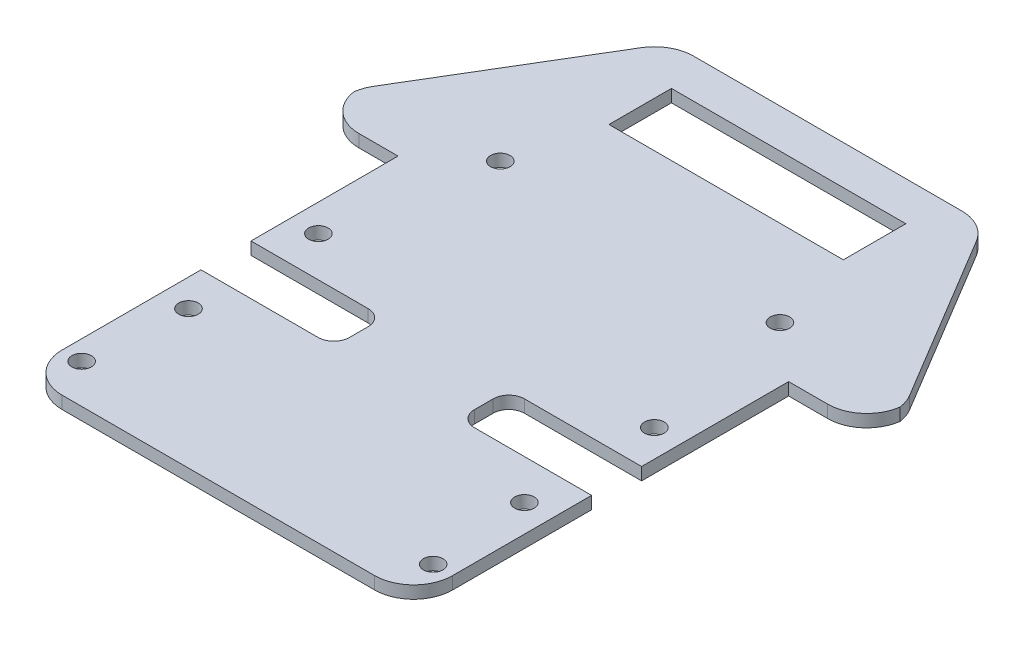
from build123d import *

# Parameters (mm, degrees)
BOSS_EXTRUDE1_DEPTH = 1.6
FILLET1_R           = 5
SKETCH2_R           = 1.25
SKETCH2_W           = 17
SKETCH2_H           = 6.4
SKETCH2_W_2         = 30
SKETCH2_H_2         = 8
CUT_EXTRUDE1_DEPTH  = 3
FILLET2_R           = 2


with BuildPart() as part:
    # Sketch1 → Boss-Extrude1 (new body)
    with BuildSketch(Plane(origin=(0, 0, 0), x_dir=(1, 0, 0), z_dir=(0, 1, 0))):
        Polygon((-20, 55.916666667), (20, 55.916666667), (35, 30.916666667), (35, 25.916666667), (25, 25.916666667), (25, -22.083333333), (-25, -22.083333333), (-25, 25.916666667), (-35, 25.916666667), (-35, 30.916666667), align=None)
    extrude(amount=BOSS_EXTRUDE1_DEPTH)

    # Fillet1
    # the kernel refuses this fillet: 5 mm, written as the material it takes off along each edge
    with BuildSketch(Plane(origin=(-20, -7.077379737, -55.916666667), x_dir=(1, 0, 0), z_dir=(0, 1, 0))) as fillet1_piece_1:
        with BuildLine():
            CenterArc((FILLET1_R * 0.566190378969, -FILLET1_R), FILLET1_R, 90, 59.036243468)
            Line((-FILLET1_R * 0.291302546743, -FILLET1_R * 0.485504244572), (0, 0))
            Line((0, 0), (FILLET1_R * 0.566190378969, 0))
        make_face()
    extrude(amount=15.754759474, mode=Mode.SUBTRACT)
    with BuildSketch(Plane(origin=(20, -7.077379737, -55.916666667), x_dir=(-1, 0, 0), z_dir=(0, 1, 0))) as fillet1_piece_2:
        with BuildLine():
            CenterArc((FILLET1_R * 0.566190378969, FILLET1_R), FILLET1_R, 210.963756532, 59.036243468)
            Line((-FILLET1_R * 0.291302546743, FILLET1_R * 0.485504244572), (0, 0))
            Line((0, 0), (FILLET1_R * 0.566190378969, 0))
        make_face()
    extrude(amount=15.754759474, mode=Mode.SUBTRACT)
    with BuildSketch(Plane(origin=(-35, -3.462299562, -30.916666667), x_dir=(0, 0, 1), z_dir=(0, 1, 0)), Plane(origin=(35, -3.462299562, -30.916666667), x_dir=(-0.5144957554275258, 0, -0.8574929257125447), z_dir=(0, 1, 0))) as fillet1_piece_3:
        with BuildLine():
            CenterArc((FILLET1_R * 0.276983964948, FILLET1_R), FILLET1_R, 239.036243468, 30.963756532)
            Line((-FILLET1_R * 0.237511790479, FILLET1_R * 0.142507074287), (0, 0))
            Line((0, 0), (FILLET1_R * 0.276983964948, 0))
        make_face()
    extrude(amount=8.524599124, mode=Mode.SUBTRACT)
    with BuildSketch(Plane(origin=(-25, -12.5, 22.083333333), x_dir=(1, 0, 0), z_dir=(0, 1, 0)), Plane(origin=(25, -12.5, 22.083333333), x_dir=(0, 0, -1), z_dir=(0, 1, 0)), Plane(origin=(-35, -12.5, -25.916666667), x_dir=(1, 0, 0), z_dir=(0, 1, 0)), Plane(origin=(35, -12.5, -25.916666667), x_dir=(0, 0, -1), z_dir=(0, 1, 0))) as fillet1_piece_4:
        with BuildLine():
            CenterArc((FILLET1_R, FILLET1_R), FILLET1_R, 180, 90)
            Line((0, FILLET1_R), (0, 0))
            Line((0, 0), (FILLET1_R, 0))
        make_face()
    extrude(amount=26.6, mode=Mode.SUBTRACT)

    # Sketch2 → Cut-Extrude1 (cut)
    with BuildSketch(Plane(origin=(0, 0, 0), x_dir=(1, 0, 0), z_dir=(0, 1, 0))):
        with Locations(Location((22.5, -17.083333333, 0), (0, 0, 90))):
            Circle(SKETCH2_R)
        with Locations(Location((21.5, -4.403333333, 0), (0, 0, 90))):
            Circle(SKETCH2_R)
        with Locations(Location((17.9, 31.906666667, 0), (0, 0, 90))):
            Circle(SKETCH2_R)
        with Locations(Location((21.5, 12.226666667, 0), (0, 0, 90))):
            Circle(SKETCH2_R)
        with Locations(Location((-17.9, 31.906666667, 0), (0, 0, 90))):
            Circle(SKETCH2_R)
        with Locations(Location((-21.5, 12.226666667, 0), (0, 0, 90))):
            Circle(SKETCH2_R)
        with Locations(Location((-21.5, -4.403333333, 0), (0, 0, 90))):
            Circle(SKETCH2_R)
        with Locations(Location((-22.5, -17.083333333, 0), (0, 0, 90))):
            Circle(SKETCH2_R)
        with Locations((16.5, 3.896666667)):
            Rectangle(SKETCH2_W, SKETCH2_H)
        with Locations((-16.5, 3.896666667)):
            Rectangle(SKETCH2_W, SKETCH2_H)
        with Locations((0, 46.916666667)):
            Rectangle(SKETCH2_W_2, SKETCH2_H_2)
    extrude(amount=CUT_EXTRUDE1_DEPTH, mode=Mode.SUBTRACT)

    # Fillet2
    fillet2_edges = [part.edges().sort_by_distance(p)[0] for p in [
        (8, 0.8, -7.096666667),
        (8, 0.8, -0.696666667),
        (-8, 0.8, -0.696666667),
        (-8, 0.8, -7.096666667),
    ]]
    fillet(fillet2_edges, radius=FILLET2_R)


solid = part.part
